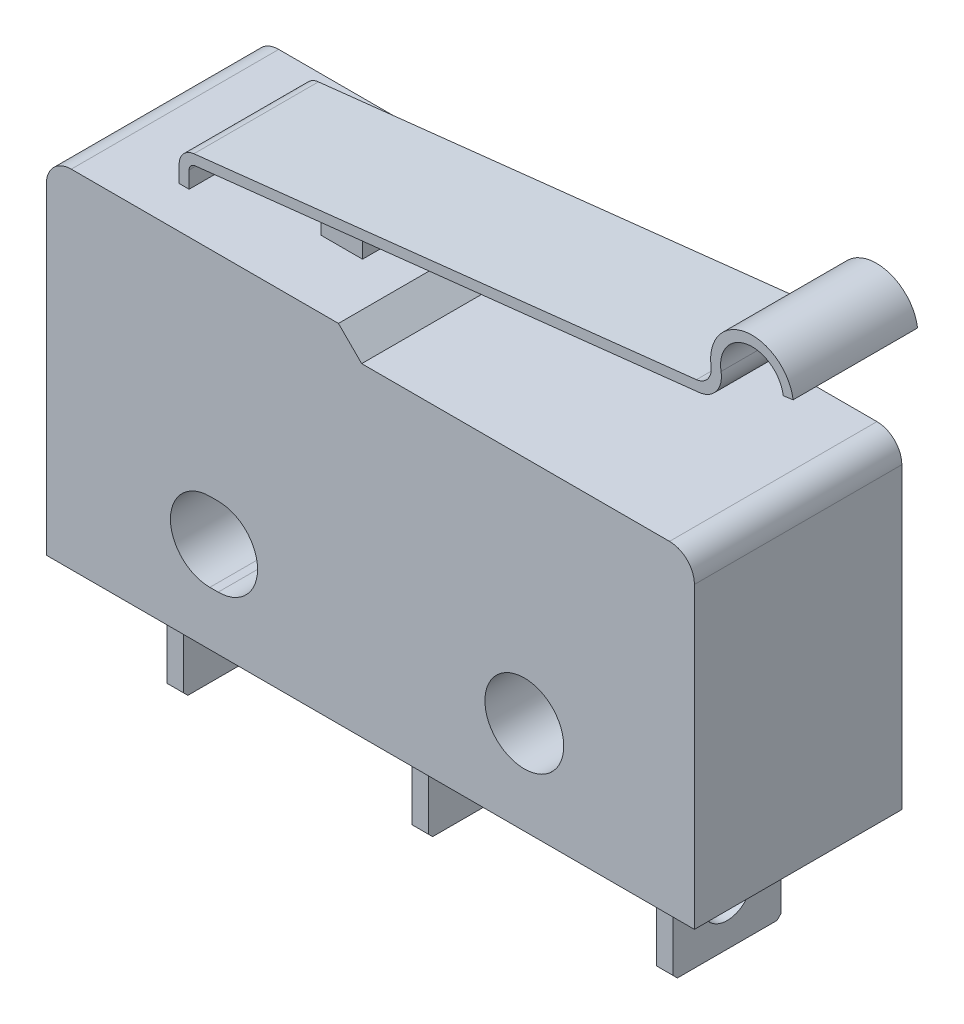
from build123d import *

# Parameters (mm, degrees)
BOSS_EXTRUDE1_START   = -2.2098
BOSS_EXTRUDE1_DEPTH   = 3.0099
BOSS_EXTRUDE1_2_DEPTH = 2.2098
BOSS_EXTRUDE2_START   = 0.8001
BOSS_EXTRUDE2_DEPTH   = 0.8001
SKETCH3_W             = 1.27
SKETCH3_H             = 2.2098
BOSS_EXTRUDE3_DEPTH   = 0.907414746
SKETCH4_W             = 0.3048
SKETCH4_H             = 3.81
BOSS_EXTRUDE4_DEPTH   = 0.693040986
SKETCH5_W             = 7.6073
SKETCH5_H             = 5.08
BOSS_EXTRUDE5_DEPTH   = 10.6172
SKETCH6_W             = 5.08
SKETCH6_H             = 10.6172
BOSS_EXTRUDE6_DEPTH   = 12.2301
SKETCH7_W             = 19.8374
SKETCH7_H             = 10.6172
BOSS_EXTRUDE7_DEPTH   = 1.27
SKETCH8_W             = 10.8966
SKETCH8_H             = 0.7112
CUT_EXTRUDE1_DEPTH    = 21.314685149
CUT_EXTRUDE2_DEPTH    = 21.314685149
SKETCH10_W            = 0.508
SKETCH10_H            = 3.302
BOSS_EXTRUDE8_DEPTH   = 3.2004
SKETCH11_W            = 0.508
SKETCH11_H            = 3.302
BOSS_EXTRUDE9_DEPTH   = 3.2004
SKETCH12_W            = 0.508
SKETCH12_H            = 3.302
BOSS_EXTRUDE10_DEPTH  = 3.2004
DRAFT1_ANGLE          = 45
SKETCH13_W            = 0.9652
SKETCH13_H            = 3.81
M2_CLEARANCE_HOLE1_D  = 2.413
HOLE1_D               = 1.524
HOLE1_DEPTH           = 4.4323
HOLE2_D               = 1.524
HOLE2_DEPTH           = 0.508
HOLE3_D               = 1.524
HOLE3_DEPTH           = 11.9253
CHAMFER1_SIZE         = 0.127
FILLET1_R             = 0.2032
FILLET2_R             = 0.508
FILLET3_R             = 0.762


with BuildPart() as part:
    # Boss-Extrude1: read off the stored shape, not the designer's step
    # Boss-Extrude1 outline → Boss-Extrude1 (new body)
    with BuildSketch(Plane.XY.offset(1.1049).offset(BOSS_EXTRUDE1_START)):
        with BuildLine():
            ThreePointArc((10.105641195, 13.182599991), (11.032749783, 13.355678114), (11.369702921, 14.236557762))
            Line((11.369702921, 14.236557762), (11.6713, 14.280628634))
            ThreePointArc((11.6713, 14.280628634), (9.96678948, 15.2854128), (9.349347434, 13.405595614))
            Line((9.349347434, 13.405595614), (-7.1247, 11.583182333))
            Line((-7.1247, 11.583182333), (-7.1247, 11.310240986))
            Line((-7.1247, 11.310240986), (-6.8199, 11.310240986))
            Line((-6.8199, 11.310240986), (10.105641195, 13.182599991))
        make_face()
    extrude(amount=BOSS_EXTRUDE1_DEPTH)

    # Boss-Extrude1 2 outline → Boss-Extrude1 2 (add)
    with BuildSketch(Plane.XY.offset(1.1049).offset(BOSS_EXTRUDE1_START)):
        with BuildLine():
            ThreePointArc((-2.3114, 11.524614746), (-2.580781823, 11.679434254), (-2.884355928, 11.745603808))
            Line((-2.884355928, 11.745603808), (-3.228598394, 11.707522575))
            ThreePointArc((-3.228598394, 11.707522575), (-3.414029171, 11.633486118), (-3.5814, 11.524614746))
            Line((-3.5814, 11.524614746), (-2.3114, 11.524614746))
        make_face()
    extrude(amount=BOSS_EXTRUDE1_2_DEPTH)

    # Sketch2 → Boss-Extrude2 (add)
    with BuildSketch(Plane(origin=(0, 0, -1.1049), x_dir=(-1, 0, 0), z_dir=(0, 0, -1)).offset(BOSS_EXTRUDE2_START)):
        with BuildLine():
            Line((6.8199, 11.310240986), (-10.105641195, 13.182599991))
            ThreePointArc((-10.105641195, 13.182599991), (-11.032749783, 13.355678114), (-11.369702921, 14.236557762))
            Line((-11.369702921, 14.236557762), (-11.6713, 14.280628634))
            ThreePointArc((-11.6713, 14.280628634), (-9.96678948, 15.2854128), (-9.349347434, 13.405595614))
            Line((-9.349347434, 13.405595614), (7.1247, 11.583182333))
            Line((7.1247, 11.583182333), (7.1247, 11.310240986))
            Line((7.1247, 11.310240986), (6.8199, 11.310240986))
        make_face()
    extrude(amount=-BOSS_EXTRUDE2_DEPTH)

    # Sketch3 → Boss-Extrude3 (add)
    with BuildSketch(Plane.XZ.offset(-11.524614746)):
        with Locations((-2.9464, 0)):
            Rectangle(SKETCH3_W, SKETCH3_H)
    extrude(amount=BOSS_EXTRUDE3_DEPTH)

    # Sketch4 → Boss-Extrude4 (add)
    with BuildSketch(Plane.XZ.offset(-11.310240986)):
        with Locations((-6.9723, 0)):
            Rectangle(SKETCH4_W, SKETCH4_H)
    extrude(amount=BOSS_EXTRUDE4_DEPTH)

    # Sketch5 → Boss-Extrude5 (add)
    with BuildSketch(Plane.XZ.offset(-10.6172)):
        with Locations((-6.11505, 0.635)):
            Rectangle(SKETCH5_W, SKETCH5_H)
    extrude(amount=BOSS_EXTRUDE5_DEPTH)

    # Sketch6 → Boss-Extrude6 (add)
    with BuildSketch(Plane(origin=(-2.3114, 0, 0), x_dir=(0, 0, -1), z_dir=(1, 0, 0))):
        with Locations((-0.635, 5.3086)):
            Rectangle(SKETCH6_W, SKETCH6_H)
    extrude(amount=BOSS_EXTRUDE6_DEPTH)

    # Sketch7 → Boss-Extrude7 (add)
    with BuildSketch(Plane(origin=(0, 0, -1.905), x_dir=(-1, 0, 0), z_dir=(0, 0, -1))):
        with Locations((0, 5.3086)):
            Rectangle(SKETCH7_W, SKETCH7_H)
    extrude(amount=BOSS_EXTRUDE7_DEPTH)

    # Sketch8 → Cut-Extrude1 (cut, through all)
    with BuildSketch(Plane(origin=(0, 0, -3.175), x_dir=(-1, 0, 0), z_dir=(0, 0, -1))):
        with Locations((-4.4704, 10.2616)):
            Rectangle(SKETCH8_W, SKETCH8_H)
    extrude(amount=-CUT_EXTRUDE1_DEPTH, mode=Mode.SUBTRACT)

    # Sketch9 → Cut-Extrude2 (cut, through all)
    with BuildSketch(Plane(origin=(0, 0, -3.175), x_dir=(-1, 0, 0), z_dir=(0, 0, -1))):
        with BuildLine():
            Line((4.9149, 4.064), (4.6609, 4.064))
            ThreePointArc((4.6609, 4.064), (3.4544, 2.8575), (4.6609, 1.651))
            Line((4.6609, 1.651), (4.9149, 1.651))
            ThreePointArc((4.9149, 1.651), (6.1214, 2.8575), (4.9149, 4.064))
        make_face()
    extrude(amount=-CUT_EXTRUDE2_DEPTH, mode=Mode.SUBTRACT)

    # Sketch10 → Boss-Extrude8 (add)
    with BuildSketch(Plane.XZ):
        Rectangle(SKETCH10_W, SKETCH10_H)
    extrude(amount=BOSS_EXTRUDE8_DEPTH)

    # Sketch11 → Boss-Extrude9 (add)
    with BuildSketch(Plane.XZ):
        with Locations((-7.493, 0)):
            Rectangle(SKETCH11_W, SKETCH11_H)
    extrude(amount=BOSS_EXTRUDE9_DEPTH)

    # Sketch12 → Boss-Extrude10 (add)
    with BuildSketch(Plane.XZ):
        with Locations((7.493, 0)):
            Rectangle(SKETCH12_W, SKETCH12_H)
    extrude(amount=BOSS_EXTRUDE10_DEPTH)

    # Draft1
    draft1_faces = [part.faces().sort_by_distance(p)[0] for p in [
        (-0.9779, 10.2616, 0),
    ]]
    draft(draft1_faces, Plane(origin=(0, 10.6172, 0), x_dir=(1, 0, 0), z_dir=(0, 1, 0)), DRAFT1_ANGLE)

    # Sketch13 → Cut-Revolve1 (revolve, cut)
    with BuildSketch(Plane.XZ.offset(-14.097)):
        with Locations((10.897245503, 0)):
            Rectangle(SKETCH13_W, SKETCH13_H)
    revolve(axis=Axis((10.414645503, 14.097, 1.905), (0, 0, -1)), mode=Mode.SUBTRACT)

    # M2 Clearance Hole1 (through all)
    with Locations(Plane.XY.offset(3.175)):
        with Locations((4.7117, 2.8575)):
            Hole(M2_CLEARANCE_HOLE1_D / 2)

    # Hole1
    with Locations(Plane.ZY.offset(-7.239)):
        with Locations((0, -1.6764)):
            Hole(HOLE1_D / 2, depth=HOLE1_DEPTH)

    # Hole2
    with Locations(Plane.ZY.offset(7.747)):
        with Locations((0, -1.6764)):
            Hole(HOLE2_D / 2, depth=HOLE2_DEPTH)

    # Hole3
    with Locations(Plane.ZY.offset(0.254)):
        with Locations((0, -1.6764)):
            Hole(HOLE3_D / 2, depth=HOLE3_DEPTH)

    # Chamfer1
    chamfer1_edges = [part.edges().sort_by_distance(p)[0] for p in [
        (0, -3.2004, -1.651),
        (0, -3.2004, 1.651),
        (-7.493, -3.2004, -1.651),
        (-7.493, -3.2004, 1.651),
        (7.493, -3.2004, -1.651),
        (7.493, -3.2004, 1.651),
    ]]
    chamfer(chamfer1_edges, length=CHAMFER1_SIZE)

    # Fillet1
    fillet1_edges = [part.edges().sort_by_distance(p)[0] for p in [
        (-6.8199, 11.310240986, 0.40005),
    ]]
    fillet(fillet1_edges, radius=FILLET1_R)

    # Fillet2
    fillet2_edges = [part.edges().sort_by_distance(p)[0] for p in [
        (-7.1247, 11.583182333, 0.40005),
        (9.349347434, 13.405595614, 0.40005),
    ]]
    fillet(fillet2_edges, radius=FILLET2_R)

    # Fillet3
    fillet3_edges = [part.edges().sort_by_distance(p)[0] for p in [
        (10.105641195, 13.182599991, 0.40005),
        (-9.9187, 10.6172, 0),
        (9.9187, 9.906, 0),
    ]]
    fillet(fillet3_edges, radius=FILLET3_R)


solid = part.part
